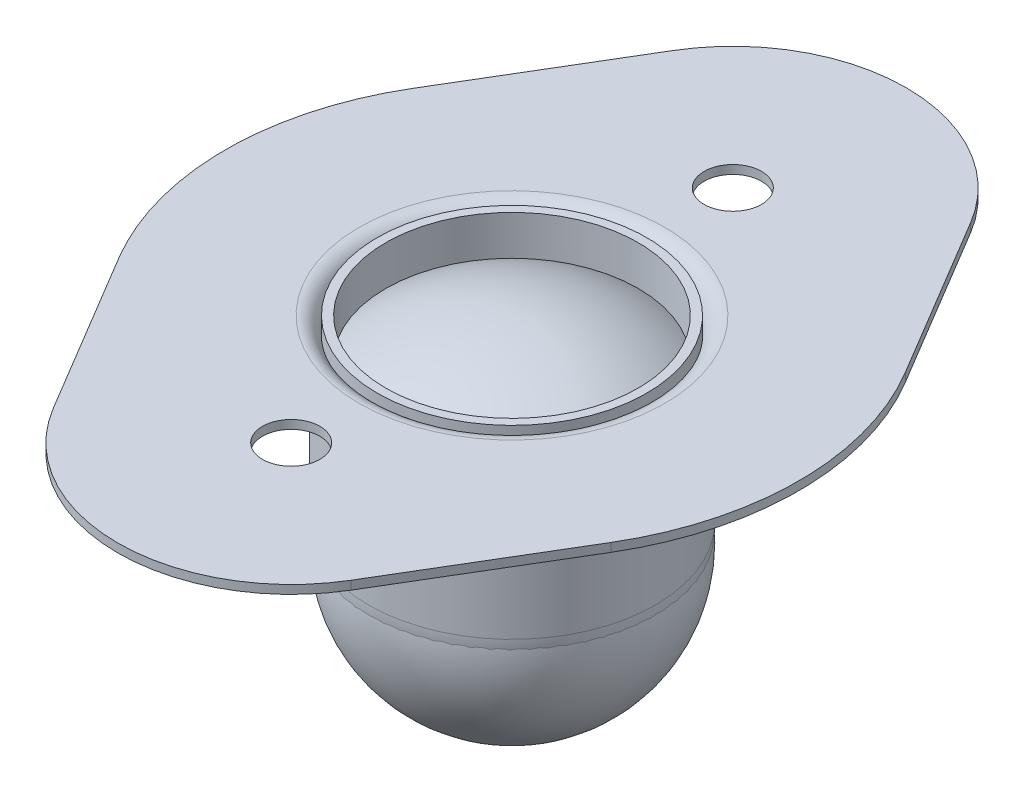
from build123d import *

# Parameters (mm, degrees)
SKETCH1_R           = 2.54
BOSS_EXTRUDE1_DEPTH = 0.762
SKETCH2_R           = 12.7
BOSS_EXTRUDE2_DEPTH = 23.84425
FILLET1_R           = 8.73125
FILLET2_R           = 1.5875
SKETCH6_R           = 3.96875
CUT_EXTRUDE3_DEPTH  = 0.762
SKETCH7_R           = 11.938
BOSS_EXTRUDE3_DEPTH = 12.7
SHELL2_T            = -0.762


# Read off the part's stored shape, not the designer's step: Shell1
with BuildPart() as part:
    # Sketch1 → Boss-Extrude1 (new body)
    with BuildSketch(Plane(origin=(0, 0, 0), x_dir=(1, 0, 0), z_dir=(0, 1, 0))):
        with BuildLine():
            Line((21.803267746, -13.02987013), (13.190976986, -27.441071429))
            ThreePointArc((13.190976986, -27.441071429), (0, -34.925), (-13.190976986, -27.441071429))
            Line((-13.190976986, -27.441071429), (-21.803267746, -13.02987013))
            ThreePointArc((-21.803267746, -13.02987013), (-25.4, 0), (-21.803267746, 13.02987013))
            Line((-21.803267746, 13.02987013), (-13.190976986, 27.441071429))
            ThreePointArc((-13.190976986, 27.441071429), (0, 34.925), (13.190976986, 27.441071429))
            Line((13.190976986, 27.441071429), (21.803267746, 13.02987013))
            ThreePointArc((21.803267746, 13.02987013), (25.4, 0), (21.803267746, -13.02987013))
        make_face()
        with Locations(Location((0, 19.558, 0), (0, 0, 90))):
            Circle(SKETCH1_R, mode=Mode.SUBTRACT)
        with Locations(Location((0, -19.558, 0), (0, 0, 90))):
            Circle(SKETCH1_R, mode=Mode.SUBTRACT)
    extrude(amount=BOSS_EXTRUDE1_DEPTH)

    # Sketch2 → Boss-Extrude2 (add)
    with BuildSketch(Plane.XZ):
        with Locations(Location((0, 0, 0), (0, 0, 90))):
            Circle(SKETCH2_R)
    extrude(amount=BOSS_EXTRUDE2_DEPTH)

    # Fillet1
    fillet1_edges = [part.edges().sort_by_distance(p)[0] for p in [
        (0, -23.84425, -12.7),
    ]]
    fillet(fillet1_edges, radius=FILLET1_R)

    # Shell1 outline → Shell1 (revolve, cut)
    with BuildSketch(Plane.XY):
        with BuildLine():
            ThreePointArc((3.96875, -23.08225), (9.603860716, -20.748110716), (11.938, -15.113))
            Line((11.938, -15.113), (11.938, 0.762))
            Line((11.938, 0.762), (0, 0.762))
            Line((0, 0.762), (0, -23.08225))
            Line((0, -23.08225), (3.96875, -23.08225))
        make_face()
    revolve(axis=Axis((0, 0, 0), (0, 1, 0)), mode=Mode.SUBTRACT)

    # Fillet2
    fillet2_edges = [part.edges().sort_by_distance(p)[0] for p in [
        (0, 0, -12.7),
        (-11.938, 0.762, 0),
    ]]
    fillet(fillet2_edges, radius=FILLET2_R)

    # Sketch6 → Cut-Extrude3 (cut)
    with BuildSketch(Plane.XZ.offset(23.84425)):
        with Locations(Location((0, 0, 0), (0, 0, 90))):
            Circle(SKETCH6_R)
    extrude(amount=-CUT_EXTRUDE3_DEPTH, mode=Mode.SUBTRACT)


with BuildPart() as body_2:
    # Sketch7 → Boss-Extrude3 (new body)
    with BuildSketch(Plane(origin=(0, 0.762, 0), x_dir=(1, 0, 0), z_dir=(0, 1, 0))):
        with Locations(Location((0, 0, 0), (0, 0, 270))):
            Circle(SKETCH7_R)
    extrude(amount=-BOSS_EXTRUDE3_DEPTH)

    # Sketch8 → Cut-Revolve1 (revolve, cut)
    with BuildSketch(Plane(origin=(0, 0, 0), x_dir=(0, 0, -1), z_dir=(1, 0, 0))):
        with BuildLine():
            Line((0, 0), (0, -11.938))
            Line((0, -11.938), (-17.4625, -11.938))
            ThreePointArc((-17.4625, -11.938), (-10.576563126, -3.269738778), (0, 0))
        make_face()
    revolve(axis=Axis((0, -30.908625, 0), (0, 1, 0)), mode=Mode.SUBTRACT)

    # Shell2
    shell2_openings = [body_2.faces().sort_by_distance(p)[0] for p in [
        (0, 0.762, 0),
    ]]
    offset(amount=SHELL2_T, openings=shell2_openings, kind=Kind.INTERSECTION)


with BuildPart() as body_3:
    # Sketch3 → Revolve1 (revolve)
    with BuildSketch(Plane(origin=(0, 0, 0), x_dir=(0, 0, -1), z_dir=(1, 0, 0))):
        with BuildLine():
            Line((0, -29.4005), (0, -4.0005))
            ThreePointArc((0, -4.0005), (-12.7, -16.7005), (0, -29.4005))
        make_face()
    revolve(axis=Axis((0, -84.371524484, 0), (0, 1, 0)))


solid = Compound([part.part, body_2.part, body_3.part])
